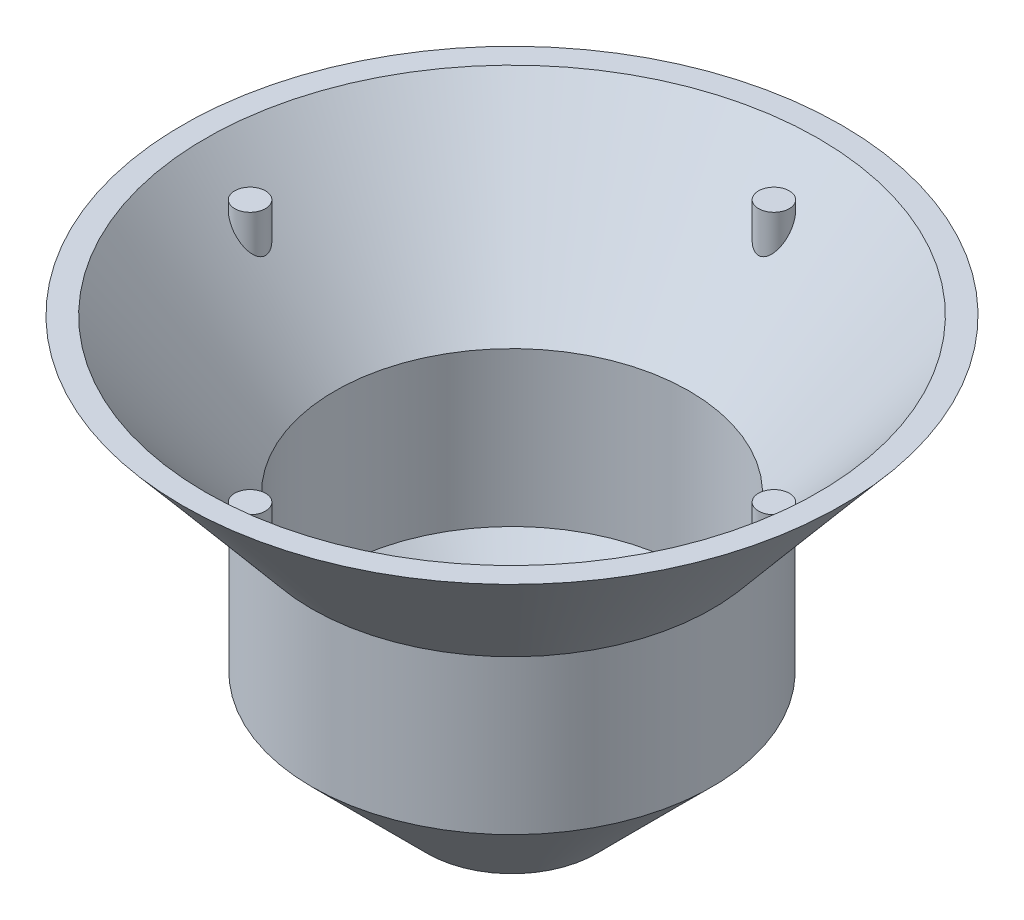
from build123d import *

# Parameters (mm, degrees)
SKETCH1_R           = 13
SKETCH1_R_2         = 11.5
BOSS_EXTRUDE1_DEPTH = 10
BOSS_EXTRUDE2_REACH = 40.265
BOSS_EXTRUDE2_START = -2
SKETCH5_R           = 1
CIRPATTERN1_COUNT   = 4


with BuildPart() as part:
    # Sketch1 → Boss-Extrude1 (new body)
    with BuildSketch(Plane(origin=(0, 0, 0), x_dir=(1, 0, 0), z_dir=(0, 1, 0))):
        with Locations(Location((0, 0, 0), (0, 0, 270))):
            Circle(SKETCH1_R)
        with Locations(Location((0, 0, 0), (0, 0, 270))):
            Circle(SKETCH1_R_2, mode=Mode.SUBTRACT)
    extrude(amount=BOSS_EXTRUDE1_DEPTH)

    # Sketch4 → Revolve1 (revolve)
    with BuildSketch(Plane.XY, mode=Mode.PRIVATE) as revolve1_sk:
        Polygon((-13, 10), (-21.390996312, 20), (-19.890996312, 20), (-11.5, 10), align=None)
    revolve(revolve1_sk.sketch.rotate(Axis((0, 18.930839499, 0), (0, -1, 0)), 270), axis=Axis((0, 18.930839499, 0), (0, -1, 0)))

    # Sketch5 → Boss-Extrude2 (add, up to next)
    with BuildSketch(Plane(origin=(0, 20, 0), x_dir=(1, 0, 0), z_dir=(0, 1, 0)).offset(BOSS_EXTRUDE2_START), mode=Mode.PRIVATE) as boss_extrude2_sk1:
        with Locations(Location((-17, 0, 0), (0, 0, 270))):
            Circle(SKETCH5_R)
    boss_extrude2_tool1 = extrude(boss_extrude2_sk1.sketch, amount=-BOSS_EXTRUDE2_REACH, mode=Mode.PRIVATE) - part.part
    boss_extrude2 = boss_extrude2_tool1.solids().sort_by_distance((-17, 18, 0))[0]
    add(boss_extrude2)

    # CirPattern1: Boss-Extrude2 ×4 about axis
    cirpattern1_axis = Axis((0, 0, 0), (0, 1, 0))
    for i in range(1, CIRPATTERN1_COUNT):
        add(boss_extrude2.rotate(cirpattern1_axis, i * 360 / CIRPATTERN1_COUNT))

    # Sketch6 → Revolve2 (revolve)
    with BuildSketch(Plane.XY, mode=Mode.PRIVATE) as revolve2_sk:
        Polygon((-13, 0), (-5.5, -7.5), (-4, -7.5), (-11.5, 0), align=None)
    revolve(revolve2_sk.sketch.rotate(Axis((0, 18.930839499, 0), (0, -1, 0)), 270), axis=Axis((0, 18.930839499, 0), (0, -1, 0)))


solid = part.part
